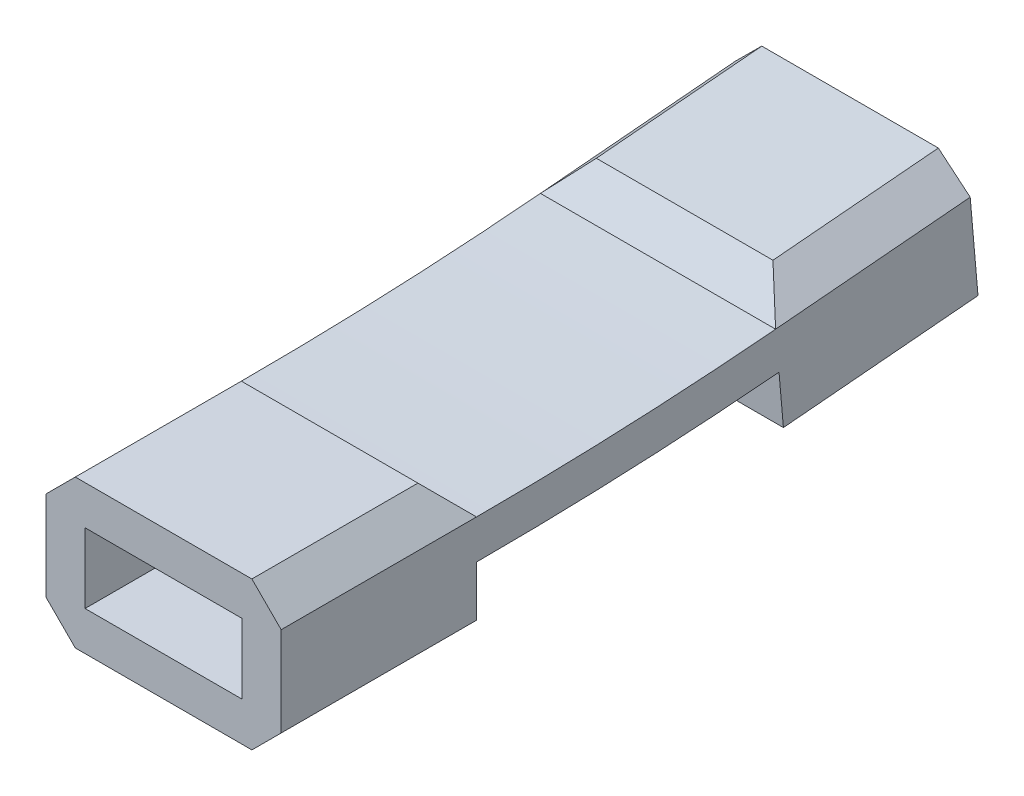
from build123d import *

# Parameters (mm, degrees)
SKETCH1_W           = 12.04
SKETCH1_H           = 7.58
SKETCH1_W_2         = 8.04
SKETCH1_H_2         = 3.58
BOSS_EXTRUDE1_DEPTH = 8
SKETCH1_2_W         = 12.04
SKETCH1_2_H         = 7.58
SKETCH1_2_W_2       = 8.04
SKETCH1_2_H_2       = 3.58
BOSS_EXTRUDE2_DEPTH = 2
EXTRUDE_THIN1_START = -12.04
EXTRUDE_THIN1_DEPTH = 12.04
SKETCH5_W           = 12.04
SKETCH5_H           = 7.58
SKETCH5_W_2         = 8.04
SKETCH5_H_2         = 3.58
BOSS_EXTRUDE4_DEPTH = 10
SKETCH5_4_W         = 12.04
SKETCH5_4_H         = 7.58
BOSS_EXTRUDE5_DEPTH = 2
CHAMFER1_SIZE       = 1.5


with BuildPart() as part:
    # Sketch1 → Boss-Extrude1 (new body)
    with BuildSketch(Plane.XY):
        Rectangle(SKETCH1_W, SKETCH1_H)
        Rectangle(SKETCH1_W_2, SKETCH1_H_2, mode=Mode.SUBTRACT)
    extrude(amount=BOSS_EXTRUDE1_DEPTH)

    # Sketch1<2> → Boss-Extrude2 (add)
    # profile 1 of 2: a face of its own
    with BuildSketch(Plane.XY):
        Rectangle(SKETCH1_2_W, SKETCH1_2_H)
        Rectangle(SKETCH1_2_W_2, SKETCH1_2_H_2, mode=Mode.SUBTRACT)
    # profile 2 of 2: a face of its own
    with BuildSketch(Plane.XY):
        Rectangle(SKETCH1_2_W_2, SKETCH1_2_H_2)
    extrude(amount=-BOSS_EXTRUDE2_DEPTH)

    # Sketch3 → Extrude-Thin1 (add)
    with BuildSketch(Plane(origin=(6.02, 9.81, 0), x_dir=(0, -1, 0), z_dir=(1, 0, 0)).offset(EXTRUDE_THIN1_START)):
        with BuildLine():
            Line((13.6, 2), (9.52, 2))
            ThreePointArc((9.52, 2), (9.350894106, 9.75), (8.843898328, 17.485247384))
            Line((8.843898328, 17.485247384), (12.908372696, 17.840842814))
            Line((12.908372696, 17.840842814), (12.734061211, 19.83323221))
            Line((12.734061211, 19.83323221), (6.665855308, 19.302332986))
            ThreePointArc((6.665855308, 19.302332986), (7.352797663, 9.662761226), (7.508614841, 0))
            Line((7.508614841, 0), (13.6, 0))
            Line((13.6, 0), (13.6, 2))
        make_face()
    extrude(amount=EXTRUDE_THIN1_DEPTH)

    # Sketch5 → Boss-Extrude4 (add)
    with BuildSketch(Plane(origin=(0, -2.22544681, -17.764471695), x_dir=(-1, 0, 0), z_dir=(0, 0.08715574274765182, -0.9961946980917462))):
        with Locations((0, 2.913739678)):
            Rectangle(SKETCH5_W, SKETCH5_H)
        with Locations((0, 2.913739678)):
            Rectangle(SKETCH5_W_2, SKETCH5_H_2, mode=Mode.SUBTRACT)
    extrude(amount=BOSS_EXTRUDE4_DEPTH)

    # Sketch5<4> → Boss-Extrude5 (add)
    with BuildSketch(Plane(origin=(0, -2.22544681, -17.764471695), x_dir=(-1, 0, 0), z_dir=(0, 0.08715574274765182, -0.9961946980917462))):
        with Locations((0, 2.913739678)):
            Rectangle(SKETCH5_4_W, SKETCH5_4_H)
    extrude(amount=BOSS_EXTRUDE5_DEPTH)

    # Chamfer1
    chamfer1_edges = [part.edges().sort_by_distance(p)[0] for p in [
        (0, -3.79, -2),
        (0, 3.79, -2),
        (-6.02, -2.662593983, -22.821816304),
        (6.02, -2.662593983, -22.821816304),
        (0, -3.098372696, -17.840842814),
        (6.02, -3.79, 3),
        (-6.02, -3.79, 3),
        (-6.02, 3.79, 3),
        (6.02, 3.79, 3),
        (0, 4.452783115, -17.180202284),
        (6.02, 4.888561829, -22.161175774),
        (-6.02, 4.888561829, -22.161175774),
    ]]
    chamfer(chamfer1_edges, length=CHAMFER1_SIZE - 0.0001)  # a hair under: the kernel refuses the full size


solid = part.part
